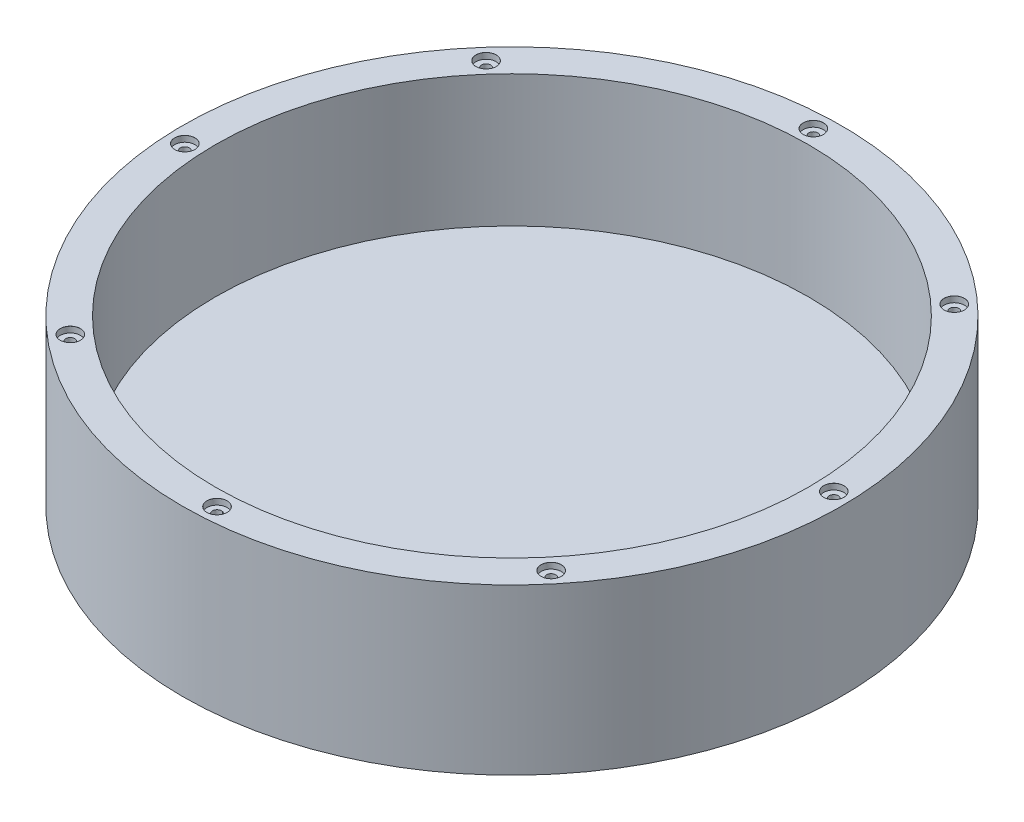
from build123d import *

# Parameters (mm, degrees)
SKETCH1_R                              = 200
BOSS_EXTRUDE1_DEPTH                    = 100
SHELL1_T                               = -20
CBORE_FOR_M5_HEX_HEAD_BOLT2_AT_2_COUNT = 2
CBORE_FOR_M5_HEX_HEAD_BOLT2_AT_2_PITCH = 269.81848572
CBORE_FOR_M5_HEX_HEAD_BOLT2_AT_3_COUNT = 2
CBORE_FOR_M5_HEX_HEAD_BOLT2_AT_3_PITCH = 269.928885586
CBORE_FOR_M5_HEX_HEAD_BOLT2_AT_4_COUNT = 2
CBORE_FOR_M5_HEX_HEAD_BOLT2_AT_4_PITCH = 379.981330262
CBORE_FOR_M5_HEX_HEAD_BOLT2_AT_5_COUNT = 2
CBORE_FOR_M5_HEX_HEAD_BOLT2_AT_5_PITCH = 347.169236891
CBORE_FOR_M5_HEX_HEAD_BOLT2_AT_6_COUNT = 2
CBORE_FOR_M5_HEX_HEAD_BOLT2_AT_6_PITCH = 143.784951156
CBORE_FOR_M5_HEX_HEAD_BOLT2_AT_7_COUNT = 2
CBORE_FOR_M5_HEX_HEAD_BOLT2_AT_7_PITCH = 353.620163975
CBORE_FOR_M5_HEX_HEAD_BOLT2_AT_8_COUNT = 2
CBORE_FOR_M5_HEX_HEAD_BOLT2_AT_8_PITCH = 149.23011883
SHELL5_START                           = 1.4
SHELL5_OUTLINE_R                       = 198.6
SHELL5_OUTLINE_R_2                     = 4.15
SHELL5_DEPTH                           = 17.2
SHELL5_START_2                         = 18.6
SHELL5_2_OUTLINE_R                     = 198.6
SHELL5_2_OUTLINE_R_2                   = 181.4
SHELL5_2_OUTLINE_R_3                   = 4.15
SHELL5_2_DEPTH                         = 76.42
SHELL5_START_3                         = 95.02
SHELL5_3_OUTLINE_R                     = 198.6
SHELL5_3_OUTLINE_R_2                   = 7.52
SHELL5_3_OUTLINE_R_3                   = 181.4
SHELL5_3_DEPTH                         = 3.58


# Read off the part's stored shape, not the designer's step: Shell5
with BuildPart() as part:
    # Sketch1 → Boss-Extrude1 (new body)
    with BuildSketch(Plane(origin=(0, 0, 0), x_dir=(1, 0, 0), z_dir=(0, 1, 0))):
        with Locations(Location((0, 0, 0), (0, 0, 270))):
            Circle(SKETCH1_R)
    extrude(amount=BOSS_EXTRUDE1_DEPTH)

    # Shell1
    shell1_openings = [part.faces().sort_by_distance(p)[0] for p in [
        (0, 100, 0),
    ]]
    offset(amount=SHELL1_T, openings=shell1_openings, kind=Kind.INTERSECTION)

    # Sketch8 → CBORE for M5 Hex Head Bolt2 (revolve, cut)
    with BuildSketch(Plane(origin=(-6.967139306, 100, -189.872217478), x_dir=(0, 0, 1), z_dir=(1, 0, 0))):
        Polygon((0, 0), (0, 100), (2.75, 100), (2.75, 3.58), (6.12, 3.58), (6.12, 0.025), (6.145, 0), align=None)
    cbore_for_m5_hex_head_bolt2 = revolve(axis=Axis((-6.967139306, 106.35, -189.872217478), (0, -1, 0)), mode=Mode.SUBTRACT)

    # CBORE for M5 Hex Head Bolt2 at 2: CBORE for M5 Hex Head Bolt2 ×2
    with Locations(*[Vector(0.7297159379092503, 0, 0.6837504295875969) * (i * CBORE_FOR_M5_HEX_HEAD_BOLT2_AT_2_PITCH) for i in range(1, CBORE_FOR_M5_HEX_HEAD_BOLT2_AT_2_COUNT)]):
        add(cbore_for_m5_hex_head_bolt2, mode=Mode.SUBTRACT)

    # CBORE for M5 Hex Head Bolt2 at 3: CBORE for M5 Hex Head Bolt2 ×2
    with Locations(*[Vector(-0.677264437721292, 0, 0.735739683174737) * (i * CBORE_FOR_M5_HEX_HEAD_BOLT2_AT_3_PITCH) for i in range(1, CBORE_FOR_M5_HEX_HEAD_BOLT2_AT_3_COUNT)]):
        add(cbore_for_m5_hex_head_bolt2, mode=Mode.SUBTRACT)

    # CBORE for M5 Hex Head Bolt2 at 4: CBORE for M5 Hex Head Bolt2 ×2
    with Locations(*[Vector(0.04657327234646247, 0, 0.9989148764048628) * (i * CBORE_FOR_M5_HEX_HEAD_BOLT2_AT_4_PITCH) for i in range(1, CBORE_FOR_M5_HEX_HEAD_BOLT2_AT_4_COUNT)]):
        add(cbore_for_m5_hex_head_bolt2, mode=Mode.SUBTRACT)

    # CBORE for M5 Hex Head Bolt2 at 5: CBORE for M5 Hex Head Bolt2 ×2
    with Locations(*[Vector(0.43983440280673813, 0, 0.8980788930309186) * (i * CBORE_FOR_M5_HEX_HEAD_BOLT2_AT_5_PITCH) for i in range(1, CBORE_FOR_M5_HEX_HEAD_BOLT2_AT_5_COUNT)]):
        add(cbore_for_m5_hex_head_bolt2, mode=Mode.SUBTRACT)

    # CBORE for M5 Hex Head Bolt2 at 6: CBORE for M5 Hex Head Bolt2 ×2
    with Locations(*[Vector(0.9389021515469056, 0, 0.344184180084721) * (i * CBORE_FOR_M5_HEX_HEAD_BOLT2_AT_6_PITCH) for i in range(1, CBORE_FOR_M5_HEX_HEAD_BOLT2_AT_6_COUNT)]):
        add(cbore_for_m5_hex_head_bolt2, mode=Mode.SUBTRACT)

    # CBORE for M5 Hex Head Bolt2 at 7: CBORE for M5 Hex Head Bolt2 ×2
    with Locations(*[Vector(-0.33172041068151087, 0, 0.943377744669276) * (i * CBORE_FOR_M5_HEX_HEAD_BOLT2_AT_7_PITCH) for i in range(1, CBORE_FOR_M5_HEX_HEAD_BOLT2_AT_7_COUNT)]):
        add(cbore_for_m5_hex_head_bolt2, mode=Mode.SUBTRACT)

    # CBORE for M5 Hex Head Bolt2 at 8: CBORE for M5 Hex Head Bolt2 ×2
    with Locations(*[Vector(-0.9046431180155808, 0, 0.4261699532194262) * (i * CBORE_FOR_M5_HEX_HEAD_BOLT2_AT_8_PITCH) for i in range(1, CBORE_FOR_M5_HEX_HEAD_BOLT2_AT_8_COUNT)]):
        add(cbore_for_m5_hex_head_bolt2, mode=Mode.SUBTRACT)

    # Shell5 outline → Shell5 (cut)
    with BuildSketch(Plane(origin=(0, 0, 0), x_dir=(1, 0, 0), z_dir=(0, 1, 0)).offset(SHELL5_START)):
        Circle(SHELL5_OUTLINE_R)
        with Locations((-124.270165325, -143.725175283)):
            Circle(SHELL5_OUTLINE_R_2, mode=Mode.SUBTRACT)
        with Locations((-189.780374227, -8.725175283)):
            Circle(SHELL5_OUTLINE_R_2, mode=Mode.SUBTRACT)
        with Locations((10.729834675, -189.696786077)):
            Circle(SHELL5_OUTLINE_R_2, mode=Mode.SUBTRACT)
        with Locations((145.729834675, -121.913146484)):
            Circle(SHELL5_OUTLINE_R_2, mode=Mode.SUBTRACT)
        with Locations((-141.967139306, 126.274824717)):
            Circle(SHELL5_OUTLINE_R_2, mode=Mode.SUBTRACT)
        with Locations((-6.967139306, 189.872217478)):
            Circle(SHELL5_OUTLINE_R_2, mode=Mode.SUBTRACT)
        with Locations((189.923710067, 5.383711956)):
            Circle(SHELL5_OUTLINE_R_2, mode=Mode.SUBTRACT)
        with Locations((128.032860694, 140.383711956)):
            Circle(SHELL5_OUTLINE_R_2, mode=Mode.SUBTRACT)
    extrude(amount=SHELL5_DEPTH, mode=Mode.SUBTRACT)

    # Shell5 2 outline → Shell5 2 (cut)
    with BuildSketch(Plane(origin=(0, 0, 0), x_dir=(1, 0, 0), z_dir=(0, 1, 0)).offset(SHELL5_START_2)):
        Circle(SHELL5_2_OUTLINE_R)
        Circle(SHELL5_2_OUTLINE_R_2, mode=Mode.SUBTRACT)
        with Locations((-124.270165325, -143.725175283)):
            Circle(SHELL5_2_OUTLINE_R_3, mode=Mode.SUBTRACT)
        with Locations((-189.780374227, -8.725175283)):
            Circle(SHELL5_2_OUTLINE_R_3, mode=Mode.SUBTRACT)
        with Locations((10.729834675, -189.696786077)):
            Circle(SHELL5_2_OUTLINE_R_3, mode=Mode.SUBTRACT)
        with Locations((145.729834675, -121.913146484)):
            Circle(SHELL5_2_OUTLINE_R_3, mode=Mode.SUBTRACT)
        with Locations((-141.967139306, 126.274824717)):
            Circle(SHELL5_2_OUTLINE_R_3, mode=Mode.SUBTRACT)
        with Locations((-6.967139306, 189.872217478)):
            Circle(SHELL5_2_OUTLINE_R_3, mode=Mode.SUBTRACT)
        with Locations((189.923710067, 5.383711956)):
            Circle(SHELL5_2_OUTLINE_R_3, mode=Mode.SUBTRACT)
        with Locations((128.032860694, 140.383711956)):
            Circle(SHELL5_2_OUTLINE_R_3, mode=Mode.SUBTRACT)
    extrude(amount=SHELL5_2_DEPTH, mode=Mode.SUBTRACT)

    # Shell5 3 outline → Shell5 3 (cut)
    with BuildSketch(Plane(origin=(0, 0, 0), x_dir=(1, 0, 0), z_dir=(0, 1, 0)).offset(SHELL5_START_3)):
        Circle(SHELL5_3_OUTLINE_R)
        with Locations((-124.270165325, -143.725175283)):
            Circle(SHELL5_3_OUTLINE_R_2, mode=Mode.SUBTRACT)
        with Locations((-189.780374227, -8.725175283)):
            Circle(SHELL5_3_OUTLINE_R_2, mode=Mode.SUBTRACT)
        with Locations((10.729834675, -189.696786077)):
            Circle(SHELL5_3_OUTLINE_R_2, mode=Mode.SUBTRACT)
        with Locations((145.729834675, -121.913146484)):
            Circle(SHELL5_3_OUTLINE_R_2, mode=Mode.SUBTRACT)
        with Locations((-141.967139306, 126.274824717)):
            Circle(SHELL5_3_OUTLINE_R_2, mode=Mode.SUBTRACT)
        with Locations((-6.967139306, 189.872217478)):
            Circle(SHELL5_3_OUTLINE_R_2, mode=Mode.SUBTRACT)
        Circle(SHELL5_3_OUTLINE_R_3, mode=Mode.SUBTRACT)
        with Locations((189.923710067, 5.383711956)):
            Circle(SHELL5_3_OUTLINE_R_2, mode=Mode.SUBTRACT)
        with Locations((128.032860694, 140.383711956)):
            Circle(SHELL5_3_OUTLINE_R_2, mode=Mode.SUBTRACT)
    extrude(amount=SHELL5_3_DEPTH, mode=Mode.SUBTRACT)


solid = part.part
